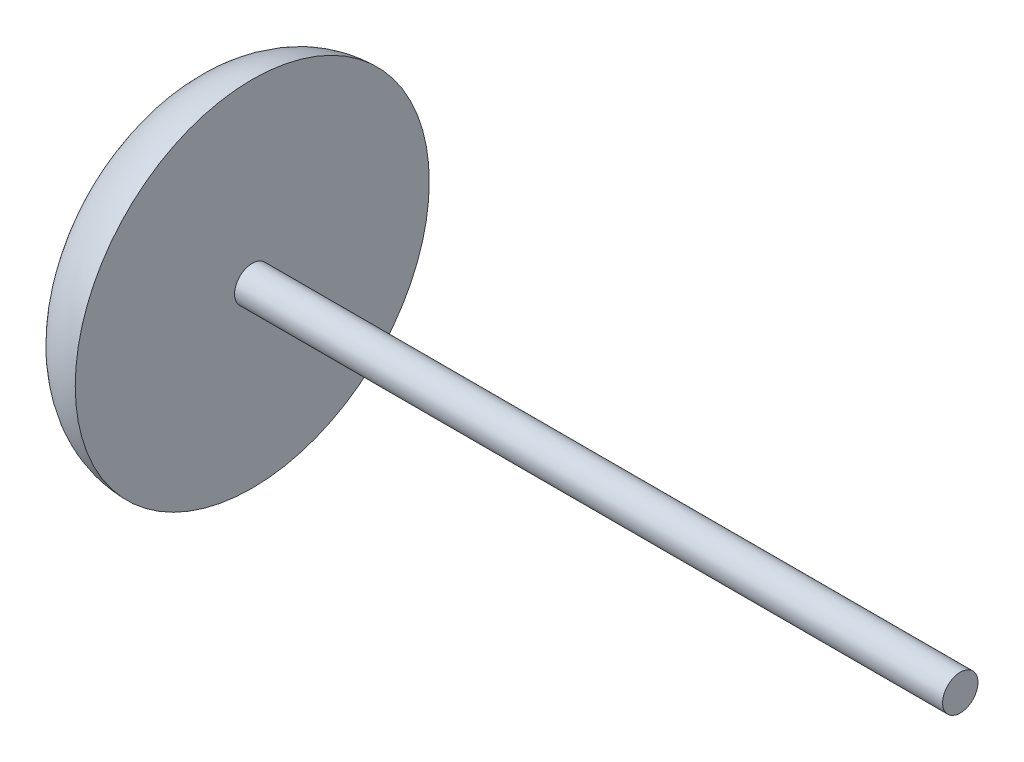
from build123d import *

# Parameters (mm, degrees)
SKETCH1_R           = 25
BOSS_EXTRUDE1_DEPTH = 110
CUT_EXTRUDE1_START  = -100
SKETCH2_R           = 25
SKETCH2_R_2         = 2.5
CUT_EXTRUDE1_DEPTH  = 100
FILLET1_R           = 10


with BuildPart() as part:
    # Sketch1 → Boss-Extrude1 (new body)
    with BuildSketch(Plane(origin=(0, 0, 0), x_dir=(0, 0, -1), z_dir=(1, 0, 0))):
        Circle(SKETCH1_R)
    extrude(amount=BOSS_EXTRUDE1_DEPTH)

    # Sketch2 → Cut-Extrude1 (cut)
    with BuildSketch(Plane(origin=(110, 0, 0), x_dir=(0, 0, -1), z_dir=(1, 0, 0)).offset(CUT_EXTRUDE1_START)):
        Circle(SKETCH2_R)
        Circle(SKETCH2_R_2, mode=Mode.SUBTRACT)
    extrude(amount=CUT_EXTRUDE1_DEPTH, mode=Mode.SUBTRACT)

    # Fillet1
    fillet1_edges = [part.edges().sort_by_distance(p)[0] for p in [
        (0, 0, 25),
    ]]
    fillet(fillet1_edges, radius=FILLET1_R - 0.0001)  # a hair under: the kernel refuses the full size


solid = part.part
